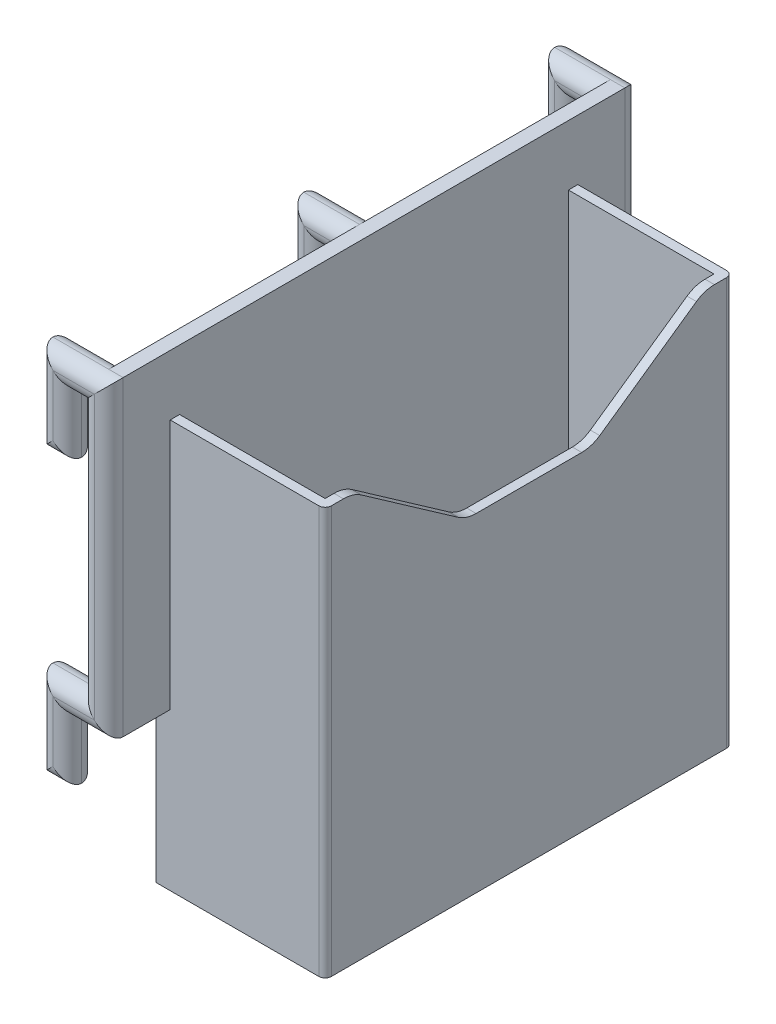
from build123d import *

# Parameters (mm, degrees)
EXTRU_MINCE1_DEPTH           = 2.3
CONG_1_R                     = 2.3
ESQUISSE2_W                  = 80
ESQUISSE2_H                  = 49.6
BOSS_EXTRU_1_DEPTH           = 2.3
R_P_TITION_START             = 77.7
R_P_TITION_LIN_AIRE1_DEPTH   = 4.6
R_P_TITION_START_2           = 37.7
R_P_TITION_LIN_AIRE1_2_DEPTH = 4.6
CONG_2_R                     = 2.3
BOSS_EXTRU_2_DEPTH           = 40
BOSS_EXTRU_2_DEPTH_BACK      = 25
BOSS_EXTRU_2_START           = -47.3
ESQUISSE5_W                  = 23.2
ESQUISSE5_H                  = 62
ENL_V_MAT_EXTRU_1_DEPTH      = 63.5
ESQUISSE6_OUTSIDE_W          = 110.274
ESQUISSE6_OUTSIDE_H          = 100.274
ENL_V_MAT_EXTRU_2_DEPTH      = 1.5


# Read off the part's stored shape, not the designer's step: Répétition linéaire1
with BuildPart() as part:
    # Esquisse1 → Extru.-Mince1 (new, symmetric)
    with BuildSketch(Plane.XY):
        Polygon((-4.3, -57), (-4.3, -47.3), (2.3, -47.3), (2.3, 2.3), (-8.9, 2.3), (-8.9, -12), (-4.3, -12), (-4.3, -2.3), (-2.3, -2.3), (-2.3, -42.7), (-8.9, -42.7), (-8.9, -57), align=None)
    extrude(amount=EXTRU_MINCE1_DEPTH, both=True)

    # Congé1
    cong_1_edges = [part.edges().sort_by_distance(p)[0] for p in [
        (-6.6, -57, -2.3),
        (-4.3, -52.15, -2.3),
        (-1, -47.3, -2.3),
        (2.3, -22.5, -2.3),
        (-3.3, 2.3, -2.3),
        (-8.9, -4.85, -2.3),
        (-6.6, -12, -2.3),
        (-4.3, -7.15, -2.3),
        (-3.3, -2.3, -2.3),
        (-2.3, -22.5, -2.3),
        (-5.6, -42.7, -2.3),
        (-8.9, -49.85, -2.3),
        (-5.6, -42.7, 2.3),
        (-2.3, -22.5, 2.3),
        (-3.3, -2.3, 2.3),
        (-4.3, -7.15, 2.3),
        (-6.6, -12, 2.3),
        (-8.9, -4.85, 2.3),
        (-3.3, 2.3, 2.3),
        (2.3, -22.5, 2.3),
        (-1, -47.3, 2.3),
        (-4.3, -52.15, 2.3),
        (-6.6, -57, 2.3),
        (-8.9, -49.85, 2.3),
    ]]
    fillet(cong_1_edges, radius=CONG_1_R - 0.0001)  # a hair under: the kernel refuses the full size

    # Esquisse2 → Boss.-Extru.1 (add)
    with BuildSketch(Plane(origin=(0, 0, 0), x_dir=(0, 0, -1), z_dir=(1, 0, 0))):
        with Locations((-40, -22.5)):
            Rectangle(ESQUISSE2_W, ESQUISSE2_H)
    extrude(amount=BOSS_EXTRU_1_DEPTH)

    # Répétition linéaire1 outline → Répétition linéaire1 (add)
    with BuildSketch(Plane.XY.offset(R_P_TITION_START)):
        Polygon((-8.9, 2.3), (-8.9, -12), (-4.3, -12), (-4.3, -2.3), (-2.3, -2.3), (-2.3, -42.7), (-8.9, -42.7), (-8.9, -57), (-4.3, -57), (-4.3, -47.3), (2.3, -47.3), (2.3, 2.3), align=None)
    extrude(amount=R_P_TITION_LIN_AIRE1_DEPTH)

    # R_p_tition lin_aire1 2 outline → R_p_tition lin_aire1 2 (add)
    with BuildSketch(Plane.XY.offset(R_P_TITION_START_2)):
        Polygon((0, 2.3), (-8.9, 2.3), (-8.9, -12), (-4.3, -12), (-4.3, -2.3), (-2.3, -2.3), (-2.3, -42.7), (-8.9, -42.7), (-8.9, -57), (-4.3, -57), (-4.3, -47.3), (0, -47.3), align=None)
    extrude(amount=R_P_TITION_LIN_AIRE1_2_DEPTH)

    # Congé2
    cong_2_edges = [part.edges().sort_by_distance(p)[0] for p in [
        (2.3, -22.5, 82.3),
        (-1, -47.3, 82.3),
        (-3.3, 2.3, 82.3),
        (-4.45, 2.3, 77.7),
        (-2.15, -47.3, 77.7),
        (-4.3, -52.15, 77.7),
        (-6.6, -57, 77.7),
        (-6.6, -12, 77.7),
        (-8.9, -4.85, 77.7),
        (-8.9, -49.85, 77.7),
        (-6.6, -57, 82.3),
        (-4.3, -52.15, 82.3),
        (-8.9, -4.85, 82.3),
        (-6.6, -12, 82.3),
        (-4.3, -7.15, 77.7),
        (-3.3, -2.3, 77.7),
        (-2.3, -22.5, 77.7),
        (-5.6, -42.7, 77.7),
        (-8.9, -49.85, 82.3),
        (-4.3, -7.15, 82.3),
        (-3.3, -2.3, 82.3),
        (-2.3, -22.5, 82.3),
        (-5.6, -42.7, 82.3),
        (-2.15, -47.3, 42.3),
        (-4.45, 2.3, 42.3),
        (-4.3, -7.15, 42.3),
        (-3.3, -2.3, 42.3),
        (-2.3, -22.5, 42.3),
        (-5.6, -42.7, 42.3),
        (-8.9, -49.85, 42.3),
        (-4.45, 2.3, 37.7),
        (-2.15, -47.3, 37.7),
        (-4.3, -52.15, 37.7),
        (-6.6, -57, 37.7),
        (-6.6, -12, 37.7),
        (-8.9, -4.85, 37.7),
        (-8.9, -49.85, 37.7),
        (-6.6, -57, 42.3),
        (-4.3, -52.15, 42.3),
        (-8.9, -4.85, 42.3),
        (-6.6, -12, 42.3),
        (-4.3, -7.15, 37.7),
        (-3.3, -2.3, 37.7),
        (-2.3, -22.5, 37.7),
        (-5.6, -42.7, 37.7),
    ]]
    fillet(cong_2_edges, radius=CONG_2_R - 0.0001)  # a hair under: the kernel refuses the full size

    # Esquisse4 → Boss.-Extru.2 (add, two sides: drawn at the far end of the back side and taken through both)
    with BuildSketch(Plane(origin=(0, 0, 0), x_dir=(1, 0, 0), z_dir=(0, 1, 0)).offset(BOSS_EXTRU_2_START - BOSS_EXTRU_2_DEPTH_BACK)):
        with BuildLine():
            Line((0, -72.5), (26, -72.5))
            ThreePointArc((26, -72.5), (26.707106781, -72.207106781), (27, -71.5))
            Line((27, -71.5), (27, -8.5))
            ThreePointArc((27, -8.5), (26.707106781, -7.792893219), (26, -7.5))
            Line((26, -7.5), (0, -7.5))
            Line((0, -7.5), (0, -72.5))
        make_face()
    extrude(amount=BOSS_EXTRU_2_DEPTH + BOSS_EXTRU_2_DEPTH_BACK)

    # Esquisse5 → Enlèv. mat.-Extru.1 (cut)
    with BuildSketch(Plane(origin=(0, -7.3, 0), x_dir=(1, 0, 0), z_dir=(0, 1, 0))):
        with Locations((13.9, -40)):
            Rectangle(ESQUISSE5_W, ESQUISSE5_H)
    extrude(amount=-ENL_V_MAT_EXTRU_1_DEPTH, mode=Mode.SUBTRACT)

    # Esquisse6 outside → Enlèv. mat.-Extru.2 (cut)
    with BuildSketch(Plane(origin=(27, 0, 0), x_dir=(0, 0, -1), z_dir=(1, 0, 0))):
        with Locations((-40, -35)):
            Rectangle(ESQUISSE6_OUTSIDE_W, ESQUISSE6_OUTSIDE_H)
        with BuildLine():
            Line((-66.708611763, -8.204239779), (-51.291388237, -18.999495909))
            ThreePointArc((-51.291388237, -18.999495909), (-49.927035053, -19.672320442), (-48.423506056, -19.903735688))
            Line((-48.423506056, -19.903735688), (-31.576493944, -19.903735688))
            ThreePointArc((-31.576493944, -19.903735688), (-30.072964947, -19.672320442), (-28.708611763, -18.999495909))
            Line((-28.708611763, -18.999495909), (-13.291388237, -8.204239779))
            ThreePointArc((-13.291388237, -8.204239779), (-11.927035053, -7.531415246), (-10.423506056, -7.3))
            Line((-10.423506056, -7.3), (-7.5, -7.3))
            Line((-7.5, -7.3), (-7.5, -72.3))
            Line((-7.5, -72.3), (-72.5, -72.3))
            Line((-72.5, -72.3), (-72.5, -7.3))
            Line((-72.5, -7.3), (-69.576493944, -7.3))
            ThreePointArc((-69.576493944, -7.3), (-68.072964947, -7.531415246), (-66.708611763, -8.204239779))
        make_face(mode=Mode.SUBTRACT)
    extrude(amount=-ENL_V_MAT_EXTRU_2_DEPTH, mode=Mode.SUBTRACT)


solid = part.part
